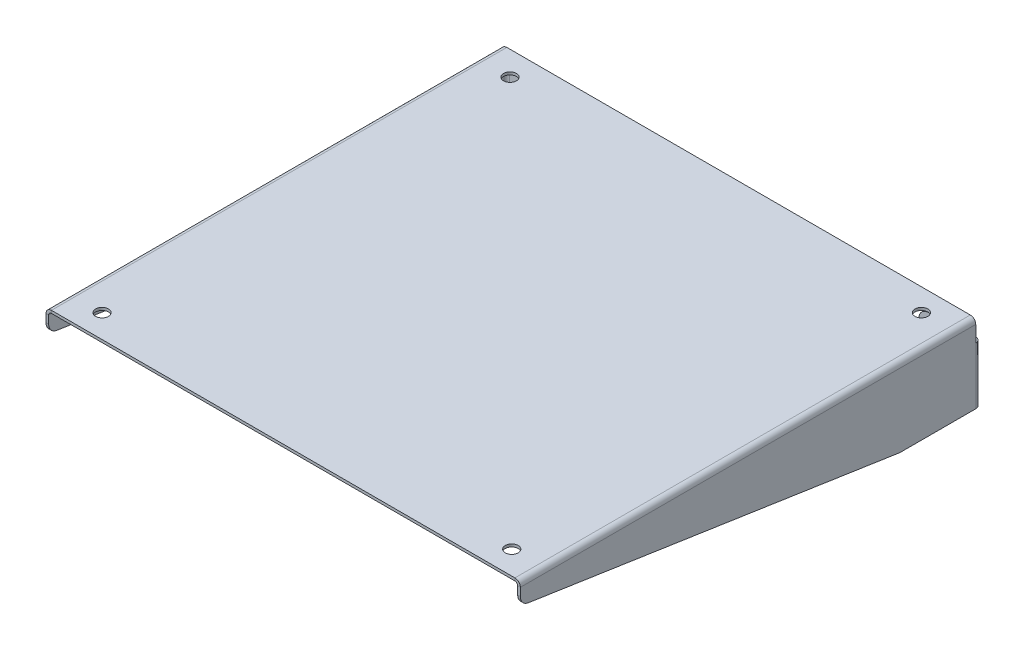
from build123d import *

# Parameters (mm, degrees)
SKETCH1_W                    = 125
SKETCH1_H                    = 120
BASE_FLANGE1_DEPTH           = 0.7
EDGE_FLANGE1_STRIP_W         = 4.2732
EDGE_FLANGE1_STRIP_H         = 0.7
EDGE_FLANGE1_STRIP_CUT_DEPTH = 120
EDGE_FLANGE1_DEPTH           = 120
EDGE_FLANGE1_FLAT_DEPTH      = 0.7
EDGE_FLANGE2_STRIP_W         = 4.2732
EDGE_FLANGE2_STRIP_H         = 0.7
EDGE_FLANGE2_STRIP_CUT_DEPTH = 120
EDGE_FLANGE2_DEPTH           = 120
EDGE_FLANGE2_FLAT_DEPTH      = 0.7
SKETCH10_R                   = 1.7
CUT_EXTRUDE1_DEPTH           = 10
EDGE_FLANGE3_DEPTH           = 15
EDGE_FLANGE4_DEPTH           = 15
F_6_CLEARANCE_HOLE1_D        = 3.7973
F_6_CLEARANCE_HOLE1_DEPTH    = 10
F_6_CLEARANCE_HOLE1_TIP      = 1.140824014
BREAK_CORNER1_START          = -1
BREAK_CORNER1_DEPTH          = 127
BREAK_CORNER1_START_2        = 123.5634
BREAK_CORNER1_2_DEPTH        = 2.4366
BREAK_CORNER1_START_3        = -2
BREAK_CORNER1_3_DEPTH        = 2
SKETCH23_W                   = 21.9
SKETCH23_H                   = 19.1
SKETCH23_W_2                 = 7.1
SKETCH23_H_2                 = 12.8
CUT_EXTRUDE2_DEPTH           = 0.7


with BuildPart() as part:
    # Base-Flange1: sheet metal written as solids
    # Sketch1 → Base-Flange1 (new body)
    with BuildSketch(Plane(origin=(0, 0, 0), x_dir=(1, 0, 0), z_dir=(0, 1, 0))):
        with Locations((62.5, -60)):
            Rectangle(SKETCH1_W, SKETCH1_H)
    extrude(amount=-BASE_FLANGE1_DEPTH)

    # Edge-Flange1: sheet metal written as solids
    # Edge-Flange1 strip (on a plane across the edge) → Edge-Flange1 strip cut (cut)
    with BuildSketch(Plane(origin=(125, -0.7, 0), x_dir=(-1, 0, 0), z_dir=(0, 0, 1))):
        with Locations((-0.7, -0.35)):
            Rectangle(EDGE_FLANGE1_STRIP_W, EDGE_FLANGE1_STRIP_H)
    extrude(amount=EDGE_FLANGE1_STRIP_CUT_DEPTH, mode=Mode.SUBTRACT)

    # Edge-Flange1 bend section (on a plane across the edge) → Edge-Flange1 (add)
    with BuildSketch(Plane(origin=(125, -0.7, 0), x_dir=(-1, 0, 0), z_dir=(0, 0, 1))):
        with BuildLine():
            Line((0, 0.7366), (0.7, 0.7366))
            ThreePointArc((0.7, 0.7366), (0.915745145, 0.215745145), (1.4366, 0))
            Line((1.4366, 0), (1.4366, -0.7))
            ThreePointArc((1.4366, -0.7), (0.420770398, -0.279229602), (0, 0.7366))
        make_face()
    extrude(amount=EDGE_FLANGE1_DEPTH)

    # Edge-Flange1 profile (on flange) → Edge-Flange1 flat (add)
    with BuildSketch(Plane(origin=(125, -0.7, 0), x_dir=(0, 0, 1), z_dir=(1, 0, 0))):
        Polygon((120, 0.7366), (120, 5), (20, 20), (0, 20), (0, 0.7366), align=None)
    extrude(amount=-EDGE_FLANGE1_FLAT_DEPTH)

    # Edge-Flange2: sheet metal written as solids
    # Edge-Flange2 strip (on a plane across the edge) → Edge-Flange2 strip cut (cut)
    with BuildSketch(Plane(origin=(0, -0.7, 120), x_dir=(1, 0, 0), z_dir=(0, 0, -1))):
        with Locations((-0.7, -0.35)):
            Rectangle(EDGE_FLANGE2_STRIP_W, EDGE_FLANGE2_STRIP_H)
    extrude(amount=EDGE_FLANGE2_STRIP_CUT_DEPTH, mode=Mode.SUBTRACT)

    # Edge-Flange2 bend section (on a plane across the edge) → Edge-Flange2 (add)
    with BuildSketch(Plane(origin=(0, -0.7, 120), x_dir=(1, 0, 0), z_dir=(0, 0, -1))):
        with BuildLine():
            Line((0, 0.7366), (0.7, 0.7366))
            ThreePointArc((0.7, 0.7366), (0.915745145, 0.215745145), (1.4366, 0))
            Line((1.4366, 0), (1.4366, -0.7))
            ThreePointArc((1.4366, -0.7), (0.420770398, -0.279229602), (0, 0.7366))
        make_face()
    extrude(amount=EDGE_FLANGE2_DEPTH)

    # Edge-Flange2 profile (on flange) → Edge-Flange2 flat (add)
    with BuildSketch(Plane(origin=(0, -0.7, 0), x_dir=(0, 0, 1), z_dir=(1, 0, 0))):
        Polygon((120, 0.7366), (120, 5), (55, 14.75), (55, 35), (0, 35), (0, 20), (0, 0.7366), align=None)
    extrude(amount=EDGE_FLANGE2_FLAT_DEPTH)

    # Sketch10 → Cut-Extrude1 (cut)
    with BuildSketch(Plane(origin=(0, 0, 0), x_dir=(1, 0, 0), z_dir=(0, 1, 0))):
        with Locations(Location((116.587265025, -113.862265027, 0), (0, 0, 270))):
            Circle(SKETCH10_R)
        with Locations(Location((116.587265025, -5.912265027, 0), (0, 0, 270))):
            Circle(SKETCH10_R)
        with Locations(Location((8.638202963, -6.362265027, 0), (0, 0, 270))):
            Circle(SKETCH10_R)
        with Locations(Location((8.638202963, -113.862265027, 0), (0, 0, 270))):
            Circle(SKETCH10_R)
    extrude(amount=-CUT_EXTRUDE1_DEPTH, mode=Mode.SUBTRACT)

    # Edge-Flange3: sheet metal written as solids
    # Edge-Flange3 section (on a plane across the edge) → Edge-Flange3 (add)
    with BuildSketch(Plane(origin=(124.3, -5.7, -0.7366), x_dir=(0, 0, 1), z_dir=(0, -1, 0))):
        with BuildLine():
            Line((-0.7, 0.7366), (-0.7, 15))
            Line((-0.7, 15), (0, 15))
            Line((0, 15), (0, 0.7366))
            ThreePointArc((0, 0.7366), (0.215745145, 0.215745145), (0.7366, 0))
            Line((0.7366, 0), (0.7366, -0.7))
            ThreePointArc((0.7366, -0.7), (-0.279229602, -0.279229602), (-0.7, 0.7366))
        make_face()
    extrude(amount=EDGE_FLANGE3_DEPTH)

    # Edge-Flange4: sheet metal written as solids
    # Edge-Flange4 section (on a plane across the edge) → Edge-Flange4 (add)
    with BuildSketch(Plane(origin=(0.7, -20.7, -0.7366), x_dir=(0, 0, 1), z_dir=(0, 1, 0))):
        with BuildLine():
            Line((-0.7, 0.7366), (-0.7, 15))
            Line((-0.7, 15), (0, 15))
            Line((0, 15), (0, 0.7366))
            ThreePointArc((0, 0.7366), (0.215745145, 0.215745145), (0.7366, 0))
            Line((0.7366, 0), (0.7366, -0.7))
            ThreePointArc((0.7366, -0.7), (-0.279229602, -0.279229602), (-0.7, 0.7366))
        make_face()
    extrude(amount=EDGE_FLANGE4_DEPTH)

    # #6 Clearance Hole1
    with Locations(Plane(origin=(0, 0, -1.4366), x_dir=(-1, 0, 0), z_dir=(0, 0, -1))):
        with Locations((-116.8, -13.2), (-8.2, -13.2)):
            Hole(F_6_CLEARANCE_HOLE1_D / 2, depth=F_6_CLEARANCE_HOLE1_DEPTH)
            with Locations((0, 0, -(F_6_CLEARANCE_HOLE1_DEPTH + F_6_CLEARANCE_HOLE1_TIP / 2))):  # 118° drill point
                Cone(0, F_6_CLEARANCE_HOLE1_D / 2, F_6_CLEARANCE_HOLE1_TIP, mode=Mode.SUBTRACT)

    # Break-Corner1: read off the stored shape, not the designer's step
    # Break-Corner1 outline → Break-Corner1 (cut)
    with BuildSketch(Plane.YZ.offset(BREAK_CORNER1_START)):
        with BuildLine():
            ThreePointArc((-6.01937233, 117.870851132), (-5.178422292, 119.394350526), (-3.547031448, 120))
            Line((-3.547031448, 120), (-5.7, 120))
            Line((-5.7, 120), (-6.01937233, 117.870851132))
        make_face()
        with BuildLine():
            ThreePointArc((-35.7, 52.5), (-34.967766953, 54.267766953), (-33.2, 55))
            Line((-33.2, 55), (-35.7, 55))
            Line((-35.7, 55), (-35.7, 52.5))
        make_face()
        with BuildLine():
            ThreePointArc((-33.2, 0), (-34.967766953, 0.732233047), (-35.7, 2.5))
            Line((-35.7, 2.5), (-35.7, 0))
            Line((-35.7, 0), (-33.2, 0))
        make_face()
    extrude(amount=BREAK_CORNER1_DEPTH, mode=Mode.SUBTRACT)

    # Break-Corner1 2 outline → Break-Corner1 2 (cut)
    with BuildSketch(Plane.YZ.offset(BREAK_CORNER1_START_2)):
        with BuildLine():
            ThreePointArc((-20.7, 19.813542987), (-20.693075631, 19.999483561), (-20.672340882, 20.184394119))
            Line((-20.672340882, 20.184394119), (-20.7, 20))
            Line((-20.7, 20), (-20.7, 19.813542987))
        make_face()
    extrude(amount=BREAK_CORNER1_2_DEPTH, mode=Mode.SUBTRACT)

    # Break-Corner1 3 outline → Break-Corner1 3 (cut)
    with BuildSketch(Plane.XY.offset(BREAK_CORNER1_START_3)):
        with BuildLine():
            ThreePointArc((13.2, -5.7), (14.967766953, -6.432233047), (15.7, -8.2))
            Line((15.7, -8.2), (15.7, -5.7))
            Line((15.7, -5.7), (13.2, -5.7))
        make_face()
        with BuildLine():
            ThreePointArc((15.7, -18.2), (14.967766953, -19.967766953), (13.2, -20.7))
            Line((13.2, -20.7), (15.7, -20.7))
            Line((15.7, -20.7), (15.7, -18.2))
        make_face()
        with BuildLine():
            ThreePointArc((111.8, -20.7), (110.032233047, -19.967766953), (109.3, -18.2))
            Line((109.3, -18.2), (109.3, -20.7))
            Line((109.3, -20.7), (111.8, -20.7))
        make_face()
        with BuildLine():
            ThreePointArc((109.3, -8.2), (110.032233047, -6.432233047), (111.8, -5.7))
            Line((111.8, -5.7), (109.3, -5.7))
            Line((109.3, -5.7), (109.3, -8.2))
        make_face()
    extrude(amount=BREAK_CORNER1_3_DEPTH, mode=Mode.SUBTRACT)

    # Sketch23 → Cut-Extrude2 (cut)
    with BuildSketch(Plane.ZY):
        with Locations((20, -18.5683)):
            Rectangle(SKETCH23_W, SKETCH23_H)
        with Locations((42, -18.5683)):
            Rectangle(SKETCH23_W_2, SKETCH23_H_2)
    extrude(amount=-CUT_EXTRUDE2_DEPTH, mode=Mode.SUBTRACT)


solid = part.part
